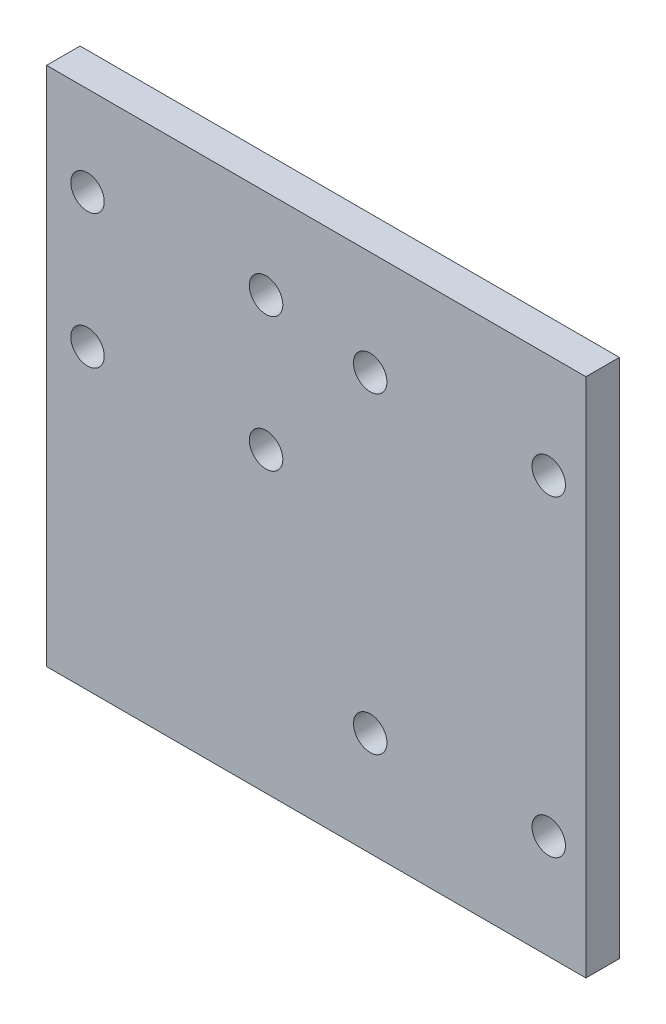
from build123d import *

# Parameters (mm, degrees)
SKETCH1_W          = 72.5
SKETCH1_H          = 70
SKETCH1_R          = 2.25
BASE_FLANGE1_DEPTH = 4.5


# Sheet-metal steps are written as plain solids
with BuildPart() as part:
    # Sketch1 → Base-Flange1 (new body)
    with BuildSketch(Plane.XY):
        with Locations((-3.976149958, 1.616858374)):
            Rectangle(SKETCH1_W, SKETCH1_H)
        with Locations(Location((-34.726149958, 24.616858374, 0), (0, 0, 180))):
            Circle(SKETCH1_R, mode=Mode.SUBTRACT)
        with Locations(Location((-10.726149958, 24.616858374, 0), (0, 0, 180))):
            Circle(SKETCH1_R, mode=Mode.SUBTRACT)
        with Locations(Location((-10.726149958, 6.616858374, 0), (0, 0, 180))):
            Circle(SKETCH1_R, mode=Mode.SUBTRACT)
        with Locations(Location((-34.726149958, 6.616858374, 0), (0, 0, 180))):
            Circle(SKETCH1_R, mode=Mode.SUBTRACT)
        with Locations(Location((3.273850042, -19.383141626, 0), (0, 0, 180))):
            Circle(SKETCH1_R, mode=Mode.SUBTRACT)
        with Locations(Location((3.273850042, 22.616858374, 0), (0, 0, 180))):
            Circle(SKETCH1_R, mode=Mode.SUBTRACT)
        with Locations(Location((27.273850042, -19.383141626, 0), (0, 0, 180))):
            Circle(SKETCH1_R, mode=Mode.SUBTRACT)
        with Locations(Location((27.273850042, 22.616858374, 0), (0, 0, 180))):
            Circle(SKETCH1_R, mode=Mode.SUBTRACT)
    extrude(amount=-BASE_FLANGE1_DEPTH)


solid = part.part
